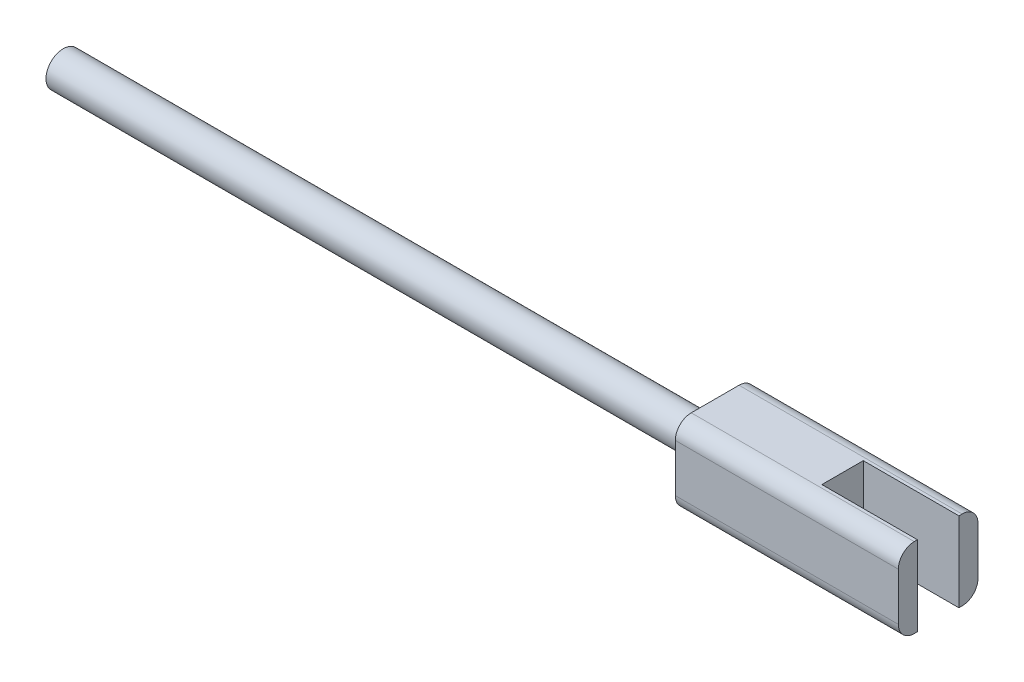
from build123d import *

# Parameters (mm, degrees)
SKETCH1_R               = 1.09
BOSS_EXTRUDE1_DEPTH     = 42.913
BOSS_EXTRUDE2_DEPTH     = 14
CUT_EXTRUDE1_DEPTH      = 56.026698693
CUT_EXTRUDE1_DEPTH_BACK = 56.026698693
SKETCH3_W               = 7
SKETCH3_H               = 2.6


with BuildPart() as part:
    # Sketch1 → Boss-Extrude1 (new body)
    with BuildSketch(Plane(origin=(0, 0, 0), x_dir=(0, 0, -1), z_dir=(1, 0, 0))):
        Circle(SKETCH1_R)
    extrude(amount=BOSS_EXTRUDE1_DEPTH)

    # Sketch2 → Boss-Extrude2 (add)
    with BuildSketch(Plane(origin=(40.913, 0, 0), x_dir=(0, 0, -1), z_dir=(1, 0, 0))):
        with BuildLine():
            Line((-1.5, -2.5), (1.5, -2.5))
            ThreePointArc((1.5, -2.5), (2.207106781, -2.207106781), (2.5, -1.5))
            Line((2.5, -1.5), (2.5, 1.5))
            ThreePointArc((2.5, 1.5), (2.207106781, 2.207106781), (1.5, 2.5))
            Line((1.5, 2.5), (-1.5, 2.5))
            ThreePointArc((-1.5, 2.5), (-2.207106781, 2.207106781), (-2.5, 1.5))
            Line((-2.5, 1.5), (-2.5, -1.5))
            ThreePointArc((-2.5, -1.5), (-2.207106781, -2.207106781), (-1.5, -2.5))
        make_face()
    extrude(amount=BOSS_EXTRUDE2_DEPTH)

    # Sketch3 → Cut-Extrude1 (cut, two sides: drawn at the far end of the back side and taken through both)
    with BuildSketch(Plane(origin=(0, 0, 0), x_dir=(1, 0, 0), z_dir=(0, 1, 0)).offset(-CUT_EXTRUDE1_DEPTH_BACK)):
        with Locations((52.413, 0)):
            Rectangle(SKETCH3_W, SKETCH3_H)
    extrude(amount=CUT_EXTRUDE1_DEPTH + CUT_EXTRUDE1_DEPTH_BACK, mode=Mode.SUBTRACT)


solid = part.part
